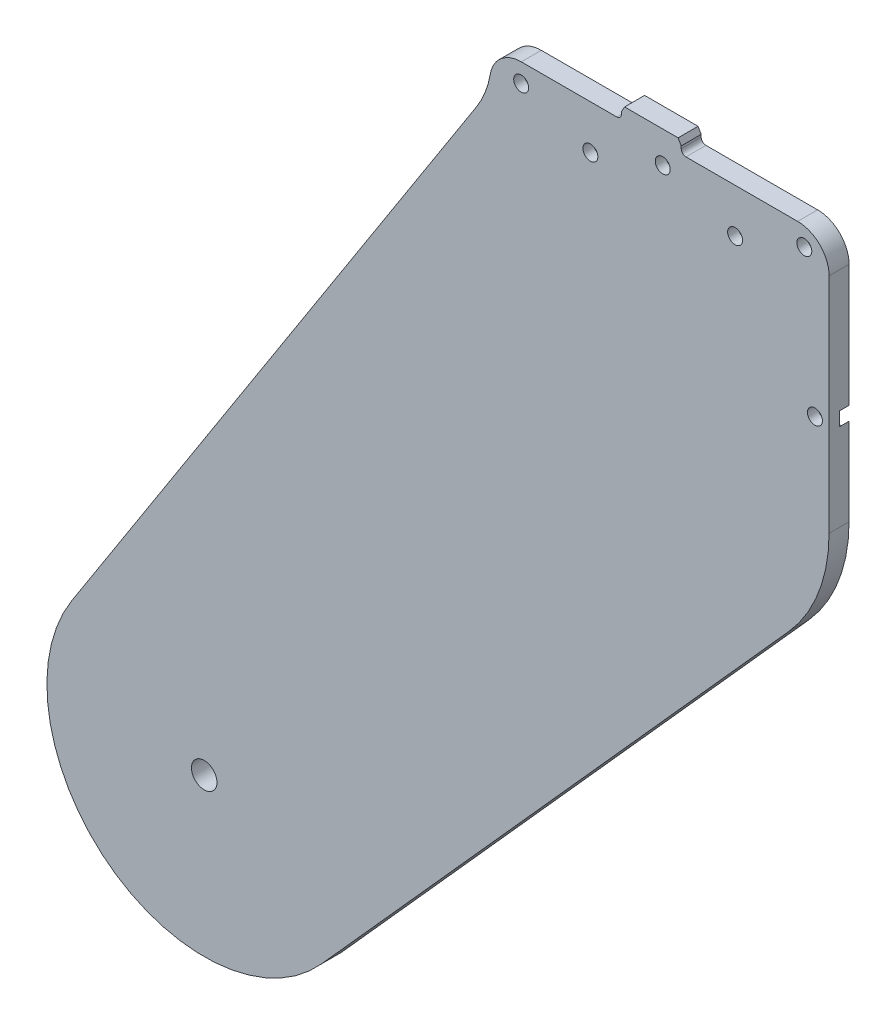
from build123d import *

# Parameters (mm, degrees)
BOSS_EXTRUDE1_DEPTH            = 6.35
FILLET1_R                      = 50
FILLET2_R                      = 30
SKETCH2_R                      = 4.05
CUT_EXTRUDE1_DEPTH             = 390.402519894
SKETCH4_W                      = 19
SKETCH4_H                      = 4
BOSS_EXTRUDE3_DEPTH            = 6.35
CHAMFER1_SIZE                  = 1
CHAMFER1_SIZE2                 = 1.732050808
FILLET3_R                      = 1.5
FILLET8_R                      = 10
CBORE_FOR_M5_SHCS2_D           = 4.75
CBORE_FOR_M5_SHCS2_CBORE_D     = 10
CBORE_FOR_M5_SHCS2_CBORE_DEPTH = 3.1


with BuildPart() as part:
    # Sketch1 → Boss-Extrude1 (new body)
    with BuildSketch(Plane.XY):
        Polygon((53.625, -52.25), (53.625, -40.25), (40.25, -40.25), (-40.25, -40.25), (-53.625, -40.25), (-53.625, -52.25), align=None)
        with BuildLine():
            Line((53.625, -140.25), (53.625, -52.25))
            Line((53.625, -52.25), (-53.625, -52.25))
            Line((-53.625, -52.25), (-187.067700458, -259.975777937))
            ThreePointArc((-187.067700458, -259.975777937), (-175.291577032, -326.779647572), (-107.761575635, -320.366146777))
            Line((-107.761575635, -320.366146777), (53.625, -140.25))
        make_face()
    extrude(amount=BOSS_EXTRUDE1_DEPTH)

    # Fillet1
    fillet1_edges = [part.edges().sort_by_distance(p)[0] for p in [
        (53.625, -140.25, 3.175),
    ]]
    fillet(fillet1_edges, radius=FILLET1_R)

    # Fillet2
    fillet2_edges = [part.edges().sort_by_distance(p)[0] for p in [
        (-53.625, -52.25, 3.175),
    ]]
    fillet(fillet2_edges, radius=FILLET2_R)

    # Sketch2 → Cut-Extrude1 (cut, through all)
    with BuildSketch(Plane(origin=(0, 0, 0), x_dir=(-1, 0, 0), z_dir=(0, 0, -1))):
        with Locations((145, -287)):
            Circle(SKETCH2_R)
    extrude(amount=-CUT_EXTRUDE1_DEPTH, mode=Mode.SUBTRACT)

    # Sketch4 → Boss-Extrude3 (add)
    with BuildSketch(Plane(origin=(0, 0, 0), x_dir=(-1, 0, 0), z_dir=(0, 0, -1))):
        with Locations((2.875, -38.25)):
            Rectangle(SKETCH4_W, SKETCH4_H)
    extrude(amount=-BOSS_EXTRUDE3_DEPTH)

    # Chamfer1
    chamfer1_edges = [part.edges().sort_by_distance(p)[0] for p in [
        (-12.375, -36.25, 3.175),
        (6.625, -36.25, 3.175),
    ]]
    chamfer1_side = [part.faces().sort_by_distance(p)[0] for p in [
        (-2.875, -36.25, 3.175),
    ]]
    chamfer(chamfer1_edges, length=CHAMFER1_SIZE, length2=CHAMFER1_SIZE2, reference=chamfer1_side[0])

    # Fillet3
    fillet3_edges = [part.edges().sort_by_distance(p)[0] for p in [
        (-12.375, -40.25, 3.175),
        (6.625, -40.25, 3.175),
    ]]
    fillet(fillet3_edges, radius=FILLET3_R)

    # Fillet8
    # the kernel refuses this fillet: 10 mm, written as the material it takes off along each edge
    with BuildSketch(Plane(origin=(53.625, -40.25, -25), x_dir=(-1, 0, 0), z_dir=(0, 0, 1))) as fillet8_piece_1:
        with BuildLine():
            CenterArc((FILLET8_R, FILLET8_R), FILLET8_R, 180, 90)
            Line((0, FILLET8_R), (0, 0))
            Line((0, 0), (FILLET8_R, 0))
        make_face()
    extrude(amount=56.35, mode=Mode.SUBTRACT)
    with BuildSketch(Plane(origin=(-53.625, -40.25, -23.541918235), x_dir=(1, 0, 0), z_dir=(0, 0, 1))) as fillet8_piece_2:
        with BuildLine():
            CenterArc((9.416767294, -10), FILLET8_R, 90, 80.203799094)
            Line((-0.43742453, -8.298558404), (-1.422843712, -8.128414244))
            ThreePointArc((-1.422843712, -8.128414244), (-1, -3.194233614), (-1, 0))
            Line((-1, 0), (0, 1))
            Line((0, 1), (9.416767294, 1))
            Line((9.416767294, 1), (9.416767294, 0))
        make_face()
    extrude(amount=53.43383647, mode=Mode.SUBTRACT)

    # CBORE for M5 SHCS2 (through all)
    with Locations(Plane(origin=(0, 0, 0), x_dir=(-1, 0, 0), z_dir=(0, 0, -1))):
        with Locations((-45.75, 26.75), (-45.75, -46.25), (-23.75, -54.25), (-0.75, -46.25), (22.25, -54.25), (44.25, -46.25), (-49.125, -91.25)):
            CounterBoreHole(CBORE_FOR_M5_SHCS2_D / 2, CBORE_FOR_M5_SHCS2_CBORE_D / 2, CBORE_FOR_M5_SHCS2_CBORE_DEPTH)


solid = part.part
